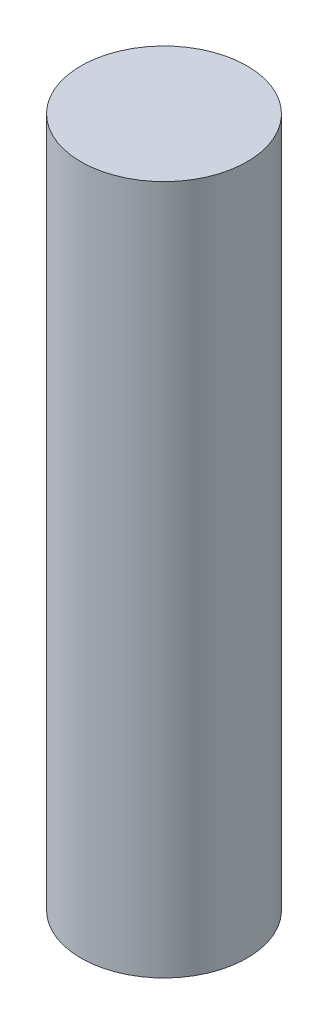
from build123d import *

# Parameters (mm, degrees)
ESQUISSE1_R        = 3
BOSS_EXTRU_1_DEPTH = 24.9


with BuildPart() as part:
    # Esquisse1 → Boss.-Extru.1 (new body)
    with BuildSketch(Plane(origin=(0, 0, 0), x_dir=(1, 0, 0), z_dir=(0, 1, 0))):
        Circle(ESQUISSE1_R)
    extrude(amount=BOSS_EXTRU_1_DEPTH)


solid = part.part
